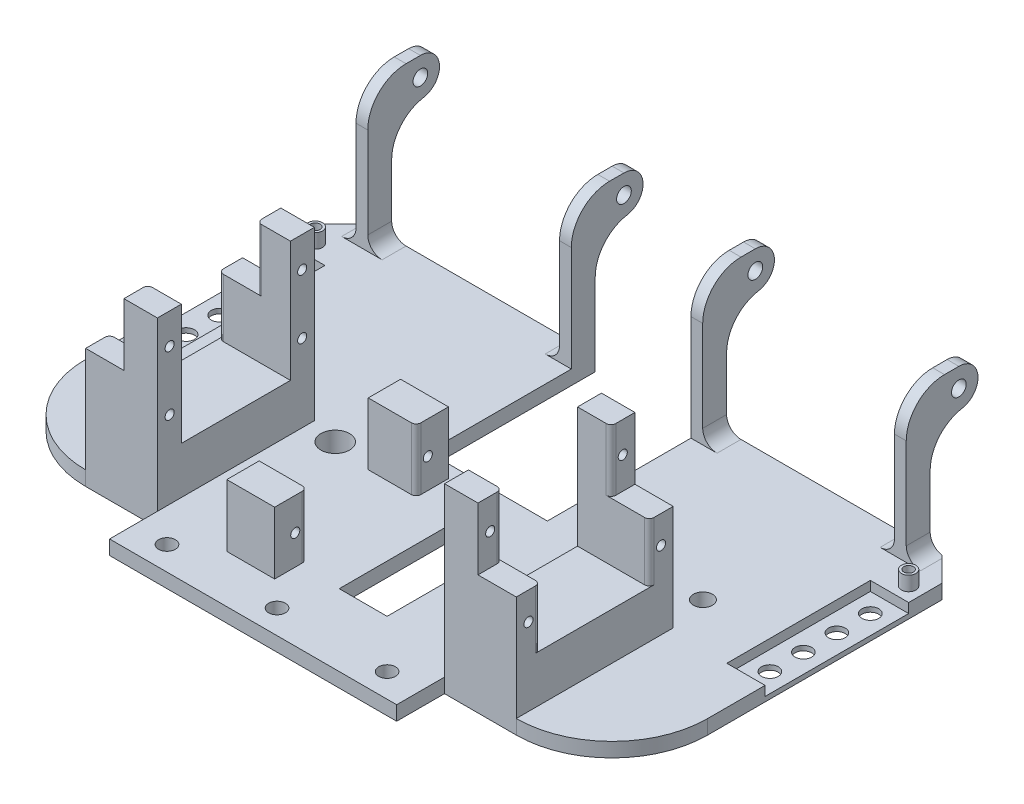
from build123d import *

# Parameters (mm, degrees)
SKETCH_1_W                = 130
SKETCH_1_H                = 100
EXTRUDE_1_DEPTH           = 3
SKETCH_16_W               = 25.45
SKETCH_16_H               = 17
EXTRUDE_7_DEPTH           = 19.8
SKETCH_17_W               = 25.45
SKETCH_17_H               = 3.5
EXTRUDE_8_DEPTH           = 22.8
SKETCH_18_W               = 25.45
SKETCH_18_H               = 10.4
EXTRUDE_9_DEPTH           = 15
CUT_EXTRUDE_8_REACH       = 119.547
SKETCH_19_W               = 11
SKETCH_19_H               = 10
FILLET_1_R                = 5
FILLET_2_R                = 5
SKETCH_20_W               = 26.08
SKETCH_20_H               = 2
CUT_EXTRUDE_9_DEPTH       = 27
SKETCH_25_R               = 1.54
EXTRUDE_11_DEPTH          = 22.5
FILLET_6_R                = 8
SKETCH_26_W               = 15
SKETCH_26_H               = 30
CUT_EXTRUDE_11_DEPTH      = 20.04
MIRROR_3_DEPTH            = 25.45
MIRROR_START              = 12.5
MIRROR_3_2_OUTLINE_R      = 1.54
MIRROR_3_2_DEPTH          = 2.46
MIRROR_START_2            = 55.04
MIRROR_3_3_OUTLINE_R      = 1.54
MIRROR_3_3_DEPTH          = 2.46
MIRROR_START_3            = 13.04
MIRROR_3_4_OUTLINE_W      = 2
MIRROR_3_4_OUTLINE_H      = 15
MIRROR_3_4_DEPTH          = 12.41
SKETCH_29_W               = 130
SKETCH_29_H               = 18
CUT_EXTRUDE_15_DEPTH      = 98.64220399
SKETCH_30_W               = 35
SKETCH_30_H               = 25
CUT_EXTRUDE_16_DEPTH      = 109.857705407
SKETCH_38_R               = 1.75
CUT_EXTRUDE_18_DEPTH      = 10
FILLET_7_R                = 3
CUT_EXTRUDE_21_DEPTH      = 98.642204056
CUT_EXTRUDE_21_DEPTH_BACK = 98.642204056
SKETCH_53_W               = 130
SKETCH_53_H               = 8
SKETCH_28_R               = 0.95
CUT_EXTRUDE_25_DEPTH      = 10
FILLET_13_R               = 1
SKETCH_60_W               = 35
SKETCH_60_H               = 7.6
CUT_EXTRUDE_28_DEPTH      = 10
SKETCH_66_W               = 58.264341246
SKETCH_66_H               = 43.34417097
CUT_EXTRUDE_32_DEPTH      = 53
CUT_EXTRUDE_33_DEPTH      = 20
CUT_EXTRUDE_33_DEPTH_BACK = 8
SKETCH_75_W               = 25
SKETCH_75_H               = 35
SKETCH_76_W               = 10
SKETCH_76_H               = 23
CUT_EXTRUDE_34_DEPTH      = 8
SKETCH_77_W               = 15
SKETCH_77_H               = 5
EXTRUDE_12_DEPTH          = 22
SKETCH_78_W               = 15
SKETCH_78_H               = 22.8
EXTRUDE_13_DEPTH          = 9.8
SKETCH_79_W               = 7
SKETCH_79_H               = 5
EXTRUDE_14_DEPTH          = 13
SKETCH_80_R               = 0.95
CUT_EXTRUDE_35_DEPTH      = 40
SKETCH_81_R               = 0.95
CUT_EXTRUDE_36_DEPTH      = 20
SKETCH_82_W               = 10
SKETCH_82_H               = 6.76114408
SKETCH_82_H_2             = 6.761144079
EXTRUDE_15_DEPTH          = 13
SKETCH_83_R               = 0.95
CUT_EXTRUDE_37_DEPTH      = 13
FILLET_14_R               = 1
FILLET_15_R               = 20
SKETCH_84_W               = 7.176235295
SKETCH_84_H               = 5.94769858
SKETCH_84_W_2             = 6.387571177
SKETCH_84_W_3             = 7.936193528
EXTRUDE_16_DEPTH          = 1
SKETCH_88_R               = 5
EXTRUDE_17_DEPTH          = 6.7
SKETCH_89_R               = 2
CUT_EXTRUDE_41_DEPTH      = 10
SKETCH_90_R               = 3
CUT_EXTRUDE_42_DEPTH      = 4.5
SKETCH_92_R               = 5
EXTRUDE_18_DEPTH          = 6.37
SKETCH_93_R               = 3
CUT_EXTRUDE_43_DEPTH      = 4.5
SKETCH_94_R               = 2
CUT_EXTRUDE_44_DEPTH      = 4.5
SKETCH_95_R               = 2
CUT_EXTRUDE_45_DEPTH      = 10
SKETCH_96_W               = 8
SKETCH_96_H               = 30
CUT_EXTRUDE_46_DEPTH      = 2
SKETCH_97_R               = 1.75
CUT_EXTRUDE_47_DEPTH      = 2
CHAMFER_1_SIZE            = 5
SKETCH_98_R               = 1.5
EXTRUDE_19_DEPTH          = 3
SKETCH_99_R               = 1
CUT_EXTRUDE_48_DEPTH      = 84.743656526
SKETCH_101_W              = 60
SKETCH_101_H              = 10
EXTRUDE_20_DEPTH          = 3
SKETCH_100_R              = 1.75
CUT_EXTRUDE_49_DEPTH      = 10


# Read off the part's stored shape, not the designer's step: 镜向3
with BuildPart() as part:
    # 草图1 → 凸台-拉伸1 (new body)
    with BuildSketch(Plane(origin=(0, 0, 0), x_dir=(1, 0, 0), z_dir=(0, 1, 0))):
        Rectangle(SKETCH_1_W, SKETCH_1_H)
    extrude(amount=EXTRUDE_1_DEPTH)

    # 草图16 → 凸台-拉伸7 (add)
    with BuildSketch(Plane(origin=(0, 3, 0), x_dir=(1, 0, 0), z_dir=(0, 1, 0))):
        with Locations((-12.725, -33.5)):
            Rectangle(SKETCH_16_W, SKETCH_16_H)
    extrude(amount=EXTRUDE_7_DEPTH)

    # 草图17 → 凸台-拉伸8 (add)
    with BuildSketch(Plane(origin=(0, 22.8, 0), x_dir=(1, 0, 0), z_dir=(0, 1, 0))):
        with Locations((-12.725, -40.25)):
            Rectangle(SKETCH_17_W, SKETCH_17_H)
    extrude(amount=EXTRUDE_8_DEPTH)

    # 草图18 → 凸台-拉伸9 (add)
    with BuildSketch(Plane.XY.offset(42)):
        with Locations((-12.725, 50.8)):
            Rectangle(SKETCH_18_W, SKETCH_18_H)
    extrude(amount=-EXTRUDE_9_DEPTH)

    # 草图19 → 切除-拉伸8 (cut, up to next)
    with BuildSketch(Plane.ZY.offset(25.45), mode=Mode.PRIVATE) as cut_extrude_8_sk1:
        with Locations((30.5, 8)):
            Rectangle(SKETCH_19_W, SKETCH_19_H)
    cut_extrude_8_tool1 = extrude(cut_extrude_8_sk1.sketch, amount=-CUT_EXTRUDE_8_REACH, mode=Mode.PRIVATE) & part.part
    add(cut_extrude_8_tool1.solids().sort_by_distance((-25.45, 8, 30.5))[0], mode=Mode.SUBTRACT)

    # 圆角1
    fillet_1_edges = [part.edges().sort_by_distance(p)[0] for p in [
        (-12.725, 3, 42),
        (-12.725, 3, 36),
    ]]
    fillet(fillet_1_edges, radius=FILLET_1_R)

    # 圆角2
    fillet_2_edges = [part.edges().sort_by_distance(p)[0] for p in [
        (-12.725, 13, 36),
    ]]
    fillet(fillet_2_edges, radius=FILLET_2_R - 0.0001)  # a hair under: the kernel refuses the full size

    # 草图20 → 切除-拉伸9 (cut)
    with BuildSketch(Plane.XY.offset(42)):
        with Locations((0, 55)):
            Rectangle(SKETCH_20_W, SKETCH_20_H)
    extrude(amount=-CUT_EXTRUDE_9_DEPTH, mode=Mode.SUBTRACT)

    # 草图25 → 凸台-拉伸11 (add, symmetric)
    with BuildSketch(Plane(origin=(-35, 0, 0), x_dir=(0, 0, -1), z_dir=(1, 0, 0))):
        with BuildLine():
            Line((38, 33), (27, 33))
            Line((27, 33), (27, 3))
            Line((27, 3), (32, 3))
            Line((32, 3), (32, 25))
            Line((32, 25), (38, 25))
            ThreePointArc((38, 25), (42, 29), (38, 33))
        make_face()
        with Locations(Location((38, 29, 0), (0, 0, 180))):
            Circle(SKETCH_25_R, mode=Mode.SUBTRACT)
    extrude(amount=EXTRUDE_11_DEPTH, both=True)

    # 圆角6
    fillet_6_edges = [part.edges().sort_by_distance(p)[0] for p in [
        (-35, 25, -32),
        (-35, 33, -27),
    ]]
    fillet(fillet_6_edges, radius=FILLET_6_R)

    # 草图26 → 切除-拉伸11 (cut, symmetric)
    with BuildSketch(Plane(origin=(-35, 0, 0), x_dir=(0, 0, -1), z_dir=(1, 0, 0))):
        with Locations((34.5, 18)):
            Rectangle(SKETCH_26_W, SKETCH_26_H)
    extrude(amount=CUT_EXTRUDE_11_DEPTH, both=True, mode=Mode.SUBTRACT)

    # 镜向3 outline → 镜向3 (add)
    with BuildSketch(Plane.YZ):
        with BuildLine():
            Line((3, 47), (3, 31))
            ThreePointArc((3, 31), (4.464466094, 34.535533906), (8, 36))
            ThreePointArc((8, 36), (11.535533906, 34.535533906), (13, 31))
            Line((13, 31), (13, 25))
            Line((13, 25), (22.8, 25))
            Line((22.8, 25), (22.8, 38.5))
            Line((22.8, 38.5), (45.6, 38.5))
            Line((45.6, 38.5), (45.6, 27))
            Line((45.6, 27), (54, 27))
            Line((54, 27), (54, 42))
            Line((54, 42), (8, 42))
            ThreePointArc((8, 42), (4.464466094, 43.464466094), (3, 47))
        make_face()
    extrude(amount=MIRROR_3_DEPTH)

    # Mirror 3 2 outline → Mirror 3 2 (add)
    with BuildSketch(Plane.YZ.offset(MIRROR_START)):
        with BuildLine():
            ThreePointArc((17.167840434, -32), (22.331818229, -33.889899073), (25.055946811, -38.666666667))
            ThreePointArc((25.055946811, -38.666666667), (29.334505041, -41.985988758), (33, -38))
            Line((33, -38), (33, -35))
            ThreePointArc((33, -35), (30.656854249, -29.343145751), (25, -27))
            Line((25, -27), (3, -27))
            Line((3, -27), (3, -32))
            Line((3, -32), (17.167840434, -32))
        make_face()
        with Locations((29, -38)):
            Circle(MIRROR_3_2_OUTLINE_R, mode=Mode.SUBTRACT)
    extrude(amount=MIRROR_3_2_DEPTH)

    # Mirror 3 3 outline → Mirror 3 3 (add)
    with BuildSketch(Plane.YZ.offset(MIRROR_START_2)):
        with BuildLine():
            ThreePointArc((17.167840434, -32), (22.331818229, -33.889899073), (25.055946811, -38.666666667))
            ThreePointArc((25.055946811, -38.666666667), (29.334505041, -41.985988758), (33, -38))
            Line((33, -38), (33, -35))
            ThreePointArc((33, -35), (30.656854249, -29.343145751), (25, -27))
            Line((25, -27), (3, -27))
            Line((3, -27), (3, -32))
            Line((3, -32), (17.167840434, -32))
        make_face()
        with Locations((29, -38)):
            Circle(MIRROR_3_3_OUTLINE_R, mode=Mode.SUBTRACT)
    extrude(amount=MIRROR_3_3_DEPTH)

    # Mirror 3 4 outline → Mirror 3 4 (add)
    with BuildSketch(Plane.YZ.offset(MIRROR_START_3)):
        with Locations((55, 34.5)):
            Rectangle(MIRROR_3_4_OUTLINE_W, MIRROR_3_4_OUTLINE_H)
    extrude(amount=MIRROR_3_4_DEPTH)

    # 草图29 → 切除-拉伸15 (cut, through all)
    with BuildSketch(Plane(origin=(0, 3, 0), x_dir=(1, 0, 0), z_dir=(0, 1, 0))):
        with Locations((0, 41)):
            Rectangle(SKETCH_29_W, SKETCH_29_H)
    extrude(amount=-CUT_EXTRUDE_15_DEPTH, mode=Mode.SUBTRACT)

    # 草图30 → 切除-拉伸16 (cut, through all)
    with BuildSketch(Plane(origin=(0, 0, 25), x_dir=(-1, 0, 0), z_dir=(0, 0, -1))):
        with Locations((0, 25.5)):
            Rectangle(SKETCH_30_W, SKETCH_30_H)
    extrude(amount=-CUT_EXTRUDE_16_DEPTH, mode=Mode.SUBTRACT)

    # 草图38 → 切除-拉伸18 (cut)
    with BuildSketch(Plane(origin=(0, 3, 0), x_dir=(1, 0, 0), z_dir=(0, 1, 0))):
        with Locations(Location((0, 25, 0), (0, 0, 270))):
            Circle(SKETCH_38_R)
    extrude(amount=-CUT_EXTRUDE_18_DEPTH, mode=Mode.SUBTRACT)

    # 圆角7
    fillet_7_edges = [part.edges().sort_by_distance(p)[0] for p in [
        (-12.5, 3, -29.5),
        (-57.5, 3, -29.5),
        (-55.04, 3, -29.5),
        (-14.96, 3, -29.5),
        (12.5, 3, -29.5),
        (57.5, 3, -29.5),
        (55.04, 3, -29.5),
        (14.96, 3, -29.5),
    ]]
    fillet(fillet_7_edges, radius=FILLET_7_R)

    # 草图53 → 切除-拉伸21 (cut, two sides: drawn at the far end of the back side and taken through both)
    with BuildSketch(Plane(origin=(0, 3, 0), x_dir=(1, 0, 0), z_dir=(0, 1, 0)).offset(-CUT_EXTRUDE_21_DEPTH_BACK)):
        with Locations((0, -46)):
            Rectangle(SKETCH_53_W, SKETCH_53_H)
    extrude(amount=CUT_EXTRUDE_21_DEPTH + CUT_EXTRUDE_21_DEPTH_BACK, mode=Mode.SUBTRACT)

    # 草图28 → 切除-拉伸25 (cut)
    with BuildSketch(Plane.ZY.offset(25.45)):
        with Locations((32.3, 48.05)):
            Circle(SKETCH_28_R)
        with Locations((32.3, 20.35)):
            Circle(SKETCH_28_R)
    extrude(amount=-CUT_EXTRUDE_25_DEPTH, mode=Mode.SUBTRACT)

    # 圆角13
    fillet_13_edges = [part.edges().sort_by_distance(p)[0] for p in [
        (-25.45, 22.8, 31.75),
        (25.45, 22.8, 31.75),
        (25.45, 45.6, 32.75),
        (-25.45, 45.6, 32.75),
    ]]
    fillet(fillet_13_edges, radius=FILLET_13_R)

    # 草图60 → 切除-拉伸28 (cut)
    with BuildSketch(Plane(origin=(0, 0, 38.5), x_dir=(-1, 0, 0), z_dir=(0, 0, -1))):
        with Locations((0, 41.8)):
            Rectangle(SKETCH_60_W, SKETCH_60_H)
    extrude(amount=-CUT_EXTRUDE_28_DEPTH, mode=Mode.SUBTRACT)

    # 草图66 → 切除-拉伸32 (cut)
    with BuildSketch(Plane(origin=(0, 56, 0), x_dir=(1, 0, 0), z_dir=(0, 1, 0))):
        with Locations((0, -42)):
            Rectangle(SKETCH_66_W, SKETCH_66_H)
    extrude(amount=-CUT_EXTRUDE_32_DEPTH, mode=Mode.SUBTRACT)

    # 草图75 → 切除-拉伸33 (cut, two sides: drawn at the far end of the back side and taken through both)
    with BuildSketch(Plane(origin=(0, 3, 0), x_dir=(1, 0, 0), z_dir=(0, 1, 0)).offset(-CUT_EXTRUDE_33_DEPTH_BACK)):
        with Locations((0, 14.5)):
            Rectangle(SKETCH_75_W, SKETCH_75_H)
    extrude(amount=CUT_EXTRUDE_33_DEPTH + CUT_EXTRUDE_33_DEPTH_BACK, mode=Mode.SUBTRACT)

    # 草图76 → 切除-拉伸34 (cut)
    with BuildSketch(Plane(origin=(0, 3, 0), x_dir=(1, 0, 0), z_dir=(0, 1, 0))):
        with Locations((8, -25.5)):
            Rectangle(SKETCH_76_W, SKETCH_76_H)
    extrude(amount=-CUT_EXTRUDE_34_DEPTH, mode=Mode.SUBTRACT)

    # 草图77 → 凸台-拉伸12 (add)
    with BuildSketch(Plane(origin=(0, 3, 0), x_dir=(1, 0, 0), z_dir=(0, 1, 0))):
        with Locations((37.5, -11.7)):
            Rectangle(SKETCH_77_W, SKETCH_77_H)
        with Locations((37.5, -39.5)):
            Rectangle(SKETCH_77_W, SKETCH_77_H)
    extrude_12 = extrude(amount=EXTRUDE_12_DEPTH)

    # 草图78 → 凸台-拉伸13 (add)
    with BuildSketch(Plane(origin=(0, 3, 0), x_dir=(1, 0, 0), z_dir=(0, 1, 0))):
        with Locations((37.5, -25.6)):
            Rectangle(SKETCH_78_W, SKETCH_78_H)
    extrude_13 = extrude(amount=EXTRUDE_13_DEPTH)

    # 草图79 → 凸台-拉伸14 (add)
    with BuildSketch(Plane(origin=(0, 25, 0), x_dir=(1, 0, 0), z_dir=(0, 1, 0))):
        with Locations((33.5, -11.7)):
            Rectangle(SKETCH_79_W, SKETCH_79_H)
        with Locations((33.5, -39.5)):
            Rectangle(SKETCH_79_W, SKETCH_79_H)
    extrude_14 = extrude(amount=EXTRUDE_14_DEPTH)

    # 草图80 → 切除-拉伸35 (cut)
    with BuildSketch(Plane(origin=(45, 0, 0), x_dir=(0, 0, -1), z_dir=(1, 0, 0))):
        with Locations((-39.45, 19.2)):
            Circle(SKETCH_80_R)
        with Locations((-11.75, 19.2)):
            Circle(SKETCH_80_R)
    cut_extrude_35 = extrude(amount=-CUT_EXTRUDE_35_DEPTH, mode=Mode.SUBTRACT)

    # 草图81 → 切除-拉伸36 (cut)
    with BuildSketch(Plane(origin=(37, 0, 0), x_dir=(0, 0, -1), z_dir=(1, 0, 0))):
        with Locations((-39.45, 31.6)):
            Circle(SKETCH_81_R)
        with Locations((-11.75, 31.6)):
            Circle(SKETCH_81_R)
    cut_extrude_36 = extrude(amount=-CUT_EXTRUDE_36_DEPTH, mode=Mode.SUBTRACT)

    # 草图82 → 凸台-拉伸15 (add)
    with BuildSketch(Plane(origin=(0, 3, 0), x_dir=(1, 0, 0), z_dir=(0, 1, 0))):
        with Locations((-10.5, -9.058283881)):
            Rectangle(SKETCH_82_W, SKETCH_82_H)
        with Locations((-10.5, -38.619427961)):
            Rectangle(SKETCH_82_W, SKETCH_82_H_2)
    extrude(amount=EXTRUDE_15_DEPTH)

    # 草图83 → 切除-拉伸37 (cut)
    with BuildSketch(Plane(origin=(-5.5, 0, 0), x_dir=(0, 0, -1), z_dir=(1, 0, 0))):
        with Locations((-37.688855921, 9.2)):
            Circle(SKETCH_83_R)
        with Locations((-9.988855921, 9.2)):
            Circle(SKETCH_83_R)
    extrude(amount=-CUT_EXTRUDE_37_DEPTH, mode=Mode.SUBTRACT)

    # 镜向4: 凸台-拉伸12, 凸台-拉伸13, 凸台-拉伸14, 切除-拉伸35, 切除-拉伸36 across plane
    add(extrude_12.mirror(Plane(origin=(0, 0, 0), x_dir=(0, 0, 1), z_dir=(1, 0, 0))))
    add(extrude_13.mirror(Plane(origin=(0, 0, 0), x_dir=(0, 0, 1), z_dir=(1, 0, 0))))
    add(extrude_14.mirror(Plane(origin=(0, 0, 0), x_dir=(0, 0, 1), z_dir=(1, 0, 0))))
    add(cut_extrude_35.mirror(Plane(origin=(0, 0, 0), x_dir=(0, 0, 1), z_dir=(1, 0, 0))), mode=Mode.SUBTRACT)
    add(cut_extrude_36.mirror(Plane(origin=(0, 0, 0), x_dir=(0, 0, 1), z_dir=(1, 0, 0))), mode=Mode.SUBTRACT)

    # 圆角14
    fillet_14_edges = [part.edges().sort_by_distance(p)[0] for p in [
        (45, 18.9, 14.2),
        (45, 18.9, 37),
        (37, 31.5, 14.2),
        (37, 31.5, 37),
        (-5.5, 9.5, 12.438855921),
        (-5.5, 9.5, 35.238855921),
        (-45, 18.9, 14.2),
        (-45, 18.9, 37),
        (-37, 31.5, 14.2),
        (-37, 31.5, 37),
    ]]
    fillet(fillet_14_edges, radius=FILLET_14_R)

    # 圆角15
    fillet_15_edges = [part.edges().sort_by_distance(p)[0] for p in [
        (65, 1.5, 42),
        (-65, 1.5, 42),
    ]]
    fillet(fillet_15_edges, radius=FILLET_15_R)

    # 草图84 → 凸台-拉伸16 (add)
    with BuildSketch(Plane.XZ):
        Polygon((12, 3), (13, 3), (13, 14), (3, 14), (-12.5, 14), (-12.5, 3), (-11.5, 3), (-11.5, 6.05230142), (-5.112428823, 6.05230142), (-5.112428823, 3), (-4.112428823, 3), (-4.112428823, 6.05230142), (3.823764705, 6.05230142), (3.823764705, 3), (4.823764705, 3), (4.823764705, 6.05230142), (12, 6.05230142), align=None)
        with Locations((8.411882353, 10.02615071)):
            Rectangle(SKETCH_84_W, SKETCH_84_H, mode=Mode.SUBTRACT)
        with Locations((-8.306214412, 10.02615071)):
            Rectangle(SKETCH_84_W_2, SKETCH_84_H, mode=Mode.SUBTRACT)
        with Locations((-0.144332059, 10.02615071)):
            Rectangle(SKETCH_84_W_3, SKETCH_84_H, mode=Mode.SUBTRACT)
    extrude(amount=EXTRUDE_16_DEPTH)

    # 草图88 → 凸台-拉伸17 (add)
    with BuildSketch(Plane(origin=(0, 3, 0), x_dir=(1, 0, 0), z_dir=(0, 1, 0))):
        with Locations(Location((-20, -25.840030692, 0), (0, 0, 270))):
            Circle(SKETCH_88_R)
        with Locations(Location((20, -25.840030692, 0), (0, 0, 270))):
            Circle(SKETCH_88_R)
    extrude(amount=-EXTRUDE_17_DEPTH)

    # 草图89 → 切除-拉伸41 (cut)
    with BuildSketch(Plane(origin=(0, 3, 0), x_dir=(1, 0, 0), z_dir=(0, 1, 0))):
        with Locations(Location((-20, -25.840030692, 0), (0, 0, 270))):
            Circle(SKETCH_89_R)
        with Locations(Location((20, -25.840030692, 0), (0, 0, 270))):
            Circle(SKETCH_89_R)
    extrude(amount=-CUT_EXTRUDE_41_DEPTH, mode=Mode.SUBTRACT)

    # 草图90 → 切除-拉伸42 (cut)
    with BuildSketch(Plane(origin=(0, 3, 0), x_dir=(1, 0, 0), z_dir=(0, 1, 0))):
        with Locations(Location((-20, -25.840030692, 0), (0, 0, 270))):
            Circle(SKETCH_90_R)
        with Locations(Location((20, -25.840030692, 0), (0, 0, 270))):
            Circle(SKETCH_90_R)
    extrude(amount=-CUT_EXTRUDE_42_DEPTH, mode=Mode.SUBTRACT)

    # 草图92 → 凸台-拉伸18 (add)
    with BuildSketch(Plane(origin=(0, 3, 0), x_dir=(1, 0, 0), z_dir=(0, 1, 0))):
        with Locations(Location((-24, -10.840030692, 0), (0, 0, 270))):
            Circle(SKETCH_92_R)
        with Locations(Location((24, -10.840030692, 0), (0, 0, 270))):
            Circle(SKETCH_92_R)
    extrude(amount=-EXTRUDE_18_DEPTH)

    # 草图93 → 切除-拉伸43 (cut)
    with BuildSketch(Plane(origin=(0, 3, 0), x_dir=(1, 0, 0), z_dir=(0, 1, 0))):
        with Locations(Location((-24, -10.840030692, 0), (0, 0, 270))):
            Circle(SKETCH_93_R)
        with Locations(Location((24, -10.840030692, 0), (0, 0, 270))):
            Circle(SKETCH_93_R)
    extrude(amount=-CUT_EXTRUDE_43_DEPTH, mode=Mode.SUBTRACT)

    # 草图94 → 切除-拉伸44 (cut)
    with BuildSketch(Plane(origin=(0, -1.5, 0), x_dir=(1, 0, 0), z_dir=(0, 1, 0))):
        with Locations(Location((-24, -10.840030692, 0), (0, 0, 270))):
            Circle(SKETCH_94_R)
        with Locations(Location((24, -10.840030692, 0), (0, 0, 270))):
            Circle(SKETCH_94_R)
    extrude(amount=-CUT_EXTRUDE_44_DEPTH, mode=Mode.SUBTRACT)

    # 草图95 → 切除-拉伸45 (cut)
    with BuildSketch(Plane(origin=(0, 3, 0), x_dir=(1, 0, 0), z_dir=(0, 1, 0))):
        with Locations(Location((-43, -1, 0), (0, 0, 270))):
            Circle(SKETCH_95_R)
        with Locations(Location((43, -1, 0), (0, 0, 270))):
            Circle(SKETCH_95_R)
    extrude(amount=-CUT_EXTRUDE_45_DEPTH, mode=Mode.SUBTRACT)

    # 草图96 → 切除-拉伸46 (cut)
    with BuildSketch(Plane(origin=(0, 3, 0), x_dir=(1, 0, 0), z_dir=(0, 1, 0))):
        with Locations((-61, 5)):
            Rectangle(SKETCH_96_W, SKETCH_96_H)
    cut_extrude_46 = extrude(amount=-CUT_EXTRUDE_46_DEPTH, mode=Mode.SUBTRACT)

    # 草图97 → 切除-拉伸47 (cut)
    with BuildSketch(Plane(origin=(0, 1, 0), x_dir=(1, 0, 0), z_dir=(0, 1, 0))):
        with Locations(Location((-61, 16, 0), (0, 0, 270))):
            Circle(SKETCH_97_R)
        with Locations(Location((-61, 9, 0), (0, 0, 270))):
            Circle(SKETCH_97_R)
        with Locations(Location((-61, 2, 0), (0, 0, 270))):
            Circle(SKETCH_97_R)
        with Locations(Location((-61, -5, 0), (0, 0, 270))):
            Circle(SKETCH_97_R)
    cut_extrude_47 = extrude(amount=-CUT_EXTRUDE_47_DEPTH, mode=Mode.SUBTRACT)

    # 镜向5: 切除-拉伸46, 切除-拉伸47 across plane
    add(cut_extrude_46.mirror(Plane(origin=(0, 0, 0), x_dir=(0, 0, 1), z_dir=(1, 0, 0))), mode=Mode.SUBTRACT)
    add(cut_extrude_47.mirror(Plane(origin=(0, 0, 0), x_dir=(0, 0, 1), z_dir=(1, 0, 0))), mode=Mode.SUBTRACT)

    # 倒角1
    chamfer_1_edges = [part.edges().sort_by_distance(p)[0] for p in [
        (-65, 1.5, -32),
        (65, 1.5, -32),
    ]]
    chamfer(chamfer_1_edges, length=CHAMFER_1_SIZE)

    # 草图98 → 凸台-拉伸19 (add)
    with BuildSketch(Plane(origin=(0, 3, 0), x_dir=(1, 0, 0), z_dir=(0, 1, 0))):
        with Locations(Location((62, 23, 0), (0, 0, 90))):
            Circle(SKETCH_98_R)
    extrude_19 = extrude(amount=EXTRUDE_19_DEPTH)

    # 草图99 → 切除-拉伸48 (cut, through all)
    with BuildSketch(Plane(origin=(0, 6, 0), x_dir=(1, 0, 0), z_dir=(0, 1, 0))):
        with Locations(Location((62, 23, 0), (0, 0, 270))):
            Circle(SKETCH_99_R)
    cut_extrude_48 = extrude(amount=-CUT_EXTRUDE_48_DEPTH, mode=Mode.SUBTRACT)

    # 镜向6: 凸台-拉伸19, 切除-拉伸48 across plane
    add(extrude_19.mirror(Plane(origin=(0, 0, 0), x_dir=(0, 0, 1), z_dir=(1, 0, 0))))
    add(cut_extrude_48.mirror(Plane(origin=(0, 0, 0), x_dir=(0, 0, 1), z_dir=(1, 0, 0))), mode=Mode.SUBTRACT)

    # 草图101 → 凸台-拉伸20 (add)
    with BuildSketch(Plane(origin=(0, 3, 0), x_dir=(1, 0, 0), z_dir=(0, 1, 0))):
        with Locations((0, -47)):
            Rectangle(SKETCH_101_W, SKETCH_101_H)
    extrude(amount=-EXTRUDE_20_DEPTH)

    # 草图100 → 切除-拉伸49 (cut)
    with BuildSketch(Plane(origin=(0, 3, 0), x_dir=(1, 0, 0), z_dir=(0, 1, 0))):
        with Locations(Location((-23, -47, 0), (0, 0, 270))):
            Circle(SKETCH_100_R)
        with Locations(Location((23, -47, 0), (0, 0, 270))):
            Circle(SKETCH_100_R)
        with Locations(Location((0, -47, 0), (0, 0, 270))):
            Circle(SKETCH_100_R)
    extrude(amount=-CUT_EXTRUDE_49_DEPTH, mode=Mode.SUBTRACT)


solid = part.part
